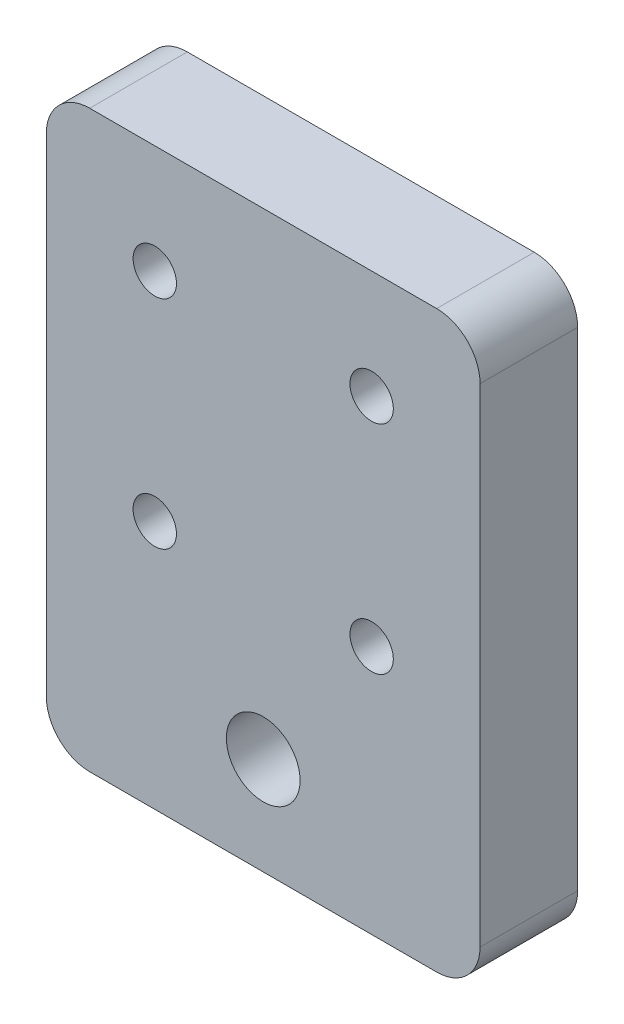
from build123d import *

# Parameters (mm, degrees)
ESQUISSE1_W             = 40
ESQUISSE1_H             = 53
BOSS_EXTRU_1_DEPTH      = 9
ESQUISSE2_R             = 2
ESQUISSE2_R_2           = 3.4
ENL_V_MAT_EXTRU_1_DEPTH = 68.007462271
CONG_1_R                = 4


with BuildPart() as part:
    # Esquisse1 → Boss.-Extru.1 (new body)
    with BuildSketch(Plane.XY):
        with Locations((20, 26.5)):
            Rectangle(ESQUISSE1_W, ESQUISSE1_H)
    extrude(amount=BOSS_EXTRU_1_DEPTH)

    # Esquisse2 → Enlèv. mat.-Extru.1 (cut, through all)
    with BuildSketch(Plane.XY.offset(9)):
        with Locations((10, 43)):
            Circle(ESQUISSE2_R)
        with Locations((30, 43)):
            Circle(ESQUISSE2_R)
        with Locations((30, 23)):
            Circle(ESQUISSE2_R)
        with Locations((10, 23)):
            Circle(ESQUISSE2_R)
        with Locations((20, 9)):
            Circle(ESQUISSE2_R_2)
    extrude(amount=-ENL_V_MAT_EXTRU_1_DEPTH, mode=Mode.SUBTRACT)

    # Congé1
    cong_1_edges = [part.edges().sort_by_distance(p)[0] for p in [
        (40, 53, 4.5),
        (40, 0, 4.5),
        (0, 0, 4.5),
        (0, 53, 4.5),
    ]]
    fillet(cong_1_edges, radius=CONG_1_R)


solid = part.part
